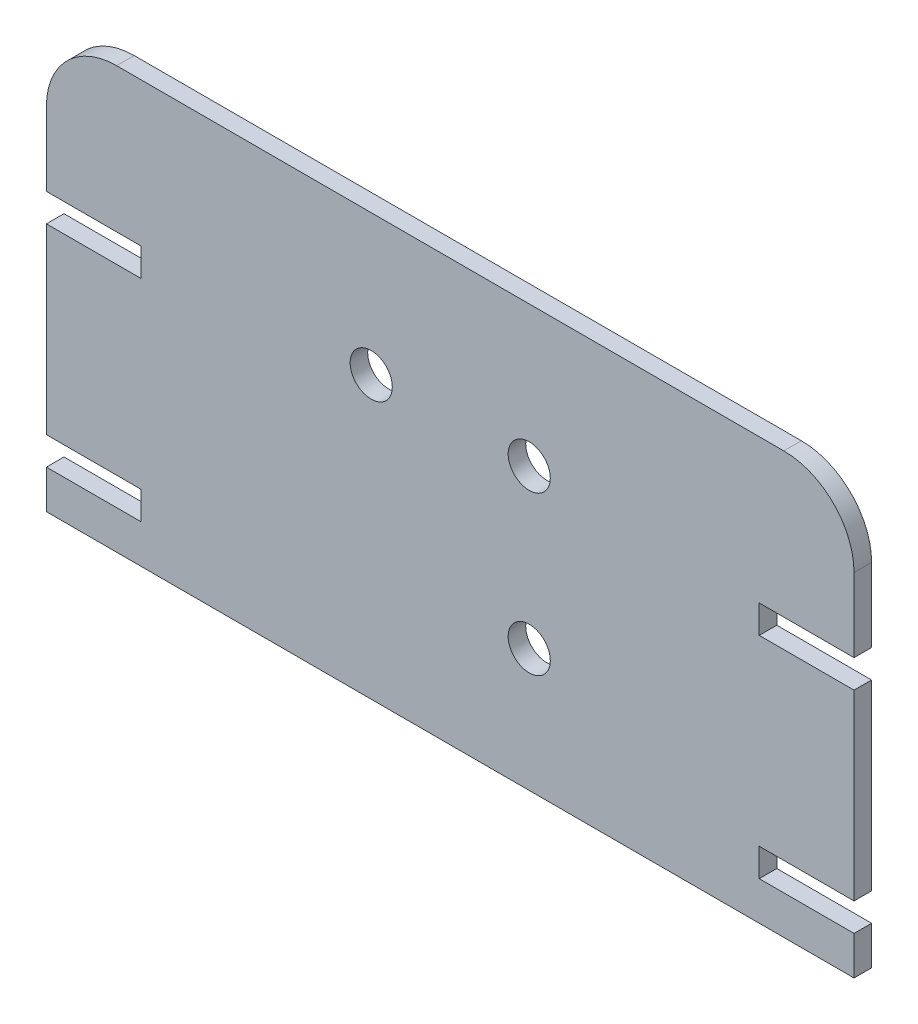
from build123d import *

# Parameters (mm, degrees)
SKETCH1_W           = 230
SKETCH1_H           = 120
BOSS_EXTRUDE1_DEPTH = 5
CUT_EXTRUDE1_REACH  = 131.808
SKETCH2_W           = 27
SKETCH2_H           = 8.000000001
CUT_EXTRUDE2_REACH  = 131.808
SKETCH3_R           = 6
FILLET1_R           = 20


with BuildPart() as part:
    # Sketch1 → Boss-Extrude1 (new body)
    with BuildSketch(Plane.XY):
        Rectangle(SKETCH1_W, SKETCH1_H)
    extrude(amount=BOSS_EXTRUDE1_DEPTH)

    # Sketch2 → Cut-Extrude1 (cut, up to next)
    with BuildSketch(Plane(origin=(0, 0, 0), x_dir=(-1, 0, 0), z_dir=(0, 0, -1)), mode=Mode.PRIVATE) as cut_extrude1_sk1:
        with Locations((101.5, 15.000000001)):
            Rectangle(SKETCH2_W, SKETCH2_H)
    cut_extrude1_tool1 = extrude(cut_extrude1_sk1.sketch, amount=-CUT_EXTRUDE1_REACH, mode=Mode.PRIVATE) & part.part
    # Sketch2 → Cut-Extrude1 (cut, up to next)
    with BuildSketch(Plane(origin=(0, 0, 0), x_dir=(-1, 0, 0), z_dir=(0, 0, -1)), mode=Mode.PRIVATE) as cut_extrude1_sk2:
        with Locations((101.5, -45.000000001)):
            Rectangle(SKETCH2_W, SKETCH2_H)
    cut_extrude1_tool2 = extrude(cut_extrude1_sk2.sketch, amount=-CUT_EXTRUDE1_REACH, mode=Mode.PRIVATE) & part.part
    # Sketch2 → Cut-Extrude1 (cut, up to next)
    with BuildSketch(Plane(origin=(0, 0, 0), x_dir=(-1, 0, 0), z_dir=(0, 0, -1)), mode=Mode.PRIVATE) as cut_extrude1_sk3:
        with Locations((-101.5, -45.000000001)):
            Rectangle(SKETCH2_W, SKETCH2_H)
    cut_extrude1_tool3 = extrude(cut_extrude1_sk3.sketch, amount=-CUT_EXTRUDE1_REACH, mode=Mode.PRIVATE) & part.part
    # Sketch2 → Cut-Extrude1 (cut, up to next)
    with BuildSketch(Plane(origin=(0, 0, 0), x_dir=(-1, 0, 0), z_dir=(0, 0, -1)), mode=Mode.PRIVATE) as cut_extrude1_sk4:
        with Locations((-101.5, 15.000000001)):
            Rectangle(SKETCH2_W, SKETCH2_H)
    cut_extrude1_tool4 = extrude(cut_extrude1_sk4.sketch, amount=-CUT_EXTRUDE1_REACH, mode=Mode.PRIVATE) & part.part
    add(cut_extrude1_tool1.solids().sort_by_distance((-101.5, 15, 0))[0], mode=Mode.SUBTRACT)
    add(cut_extrude1_tool2.solids().sort_by_distance((-101.5, -45, 0))[0], mode=Mode.SUBTRACT)
    add(cut_extrude1_tool3.solids().sort_by_distance((101.5, -45, 0))[0], mode=Mode.SUBTRACT)
    add(cut_extrude1_tool4.solids().sort_by_distance((101.5, 15, 0))[0], mode=Mode.SUBTRACT)

    # Sketch3 → Cut-Extrude2 (cut, up to next)
    with BuildSketch(Plane.XY.offset(5), mode=Mode.PRIVATE) as cut_extrude2_sk1:
        with Locations((22.5, 20)):
            Circle(SKETCH3_R)
    cut_extrude2_tool1 = extrude(cut_extrude2_sk1.sketch, amount=-CUT_EXTRUDE2_REACH, mode=Mode.PRIVATE) & part.part
    # Sketch3 → Cut-Extrude2 (cut, up to next)
    with BuildSketch(Plane.XY.offset(5), mode=Mode.PRIVATE) as cut_extrude2_sk2:
        with Locations((-22.5, 20)):
            Circle(SKETCH3_R)
    cut_extrude2_tool2 = extrude(cut_extrude2_sk2.sketch, amount=-CUT_EXTRUDE2_REACH, mode=Mode.PRIVATE) & part.part
    # Sketch3 → Cut-Extrude2 (cut, up to next)
    with BuildSketch(Plane.XY.offset(5), mode=Mode.PRIVATE) as cut_extrude2_sk3:
        with Locations((22.5, -25)):
            Circle(SKETCH3_R)
    cut_extrude2_tool3 = extrude(cut_extrude2_sk3.sketch, amount=-CUT_EXTRUDE2_REACH, mode=Mode.PRIVATE) & part.part
    add(cut_extrude2_tool1.solids().sort_by_distance((22.5, 20, 5))[0], mode=Mode.SUBTRACT)
    add(cut_extrude2_tool2.solids().sort_by_distance((-22.5, 20, 5))[0], mode=Mode.SUBTRACT)
    add(cut_extrude2_tool3.solids().sort_by_distance((22.5, -25, 5))[0], mode=Mode.SUBTRACT)

    # Fillet1
    fillet1_edges = [part.edges().sort_by_distance(p)[0] for p in [
        (115, 60, 2.5),
        (-115, 60, 2.5),
    ]]
    fillet(fillet1_edges, radius=FILLET1_R)


solid = part.part
